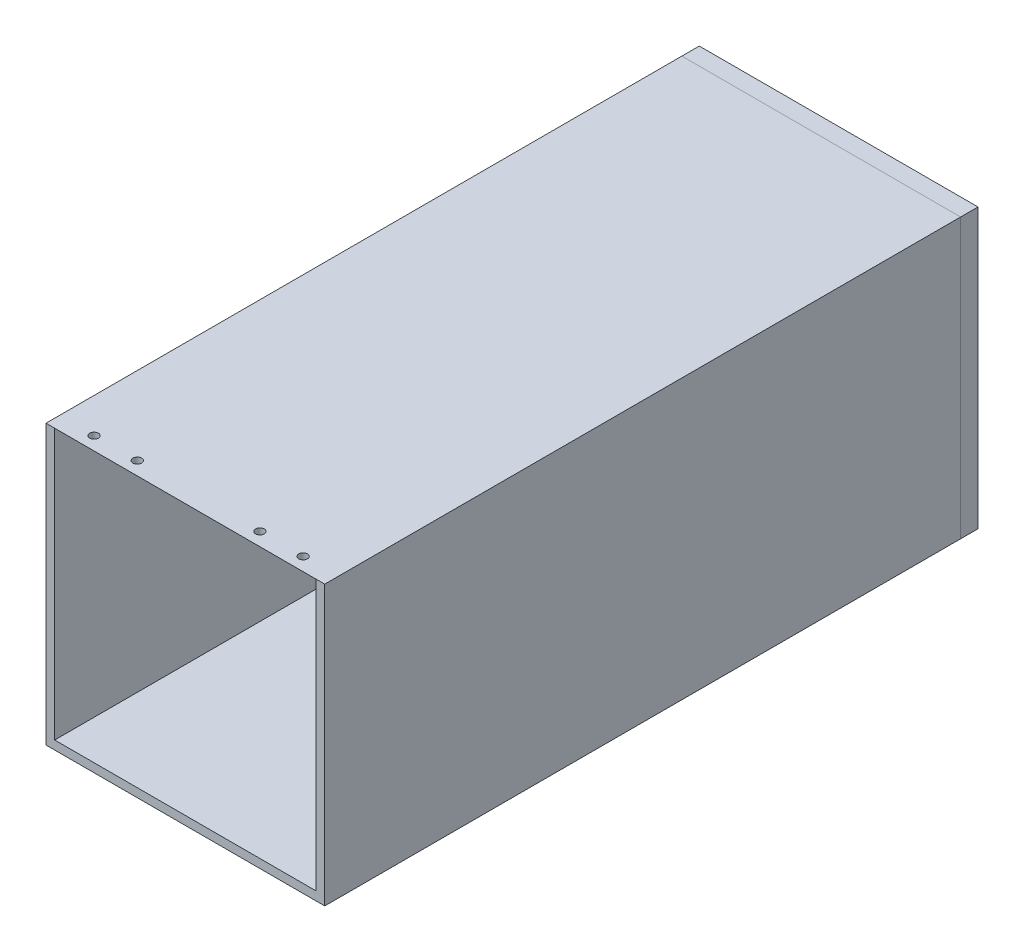
from build123d import *

# Parameters (mm, degrees)
SKETCH1_W           = 101.6
SKETCH1_H           = 101.6
SKETCH1_W_2         = 95.25
SKETCH1_H_2         = 95.25
BOSS_EXTRUDE1_DEPTH = 231.775
SKETCH2_W           = 101.6
SKETCH2_H           = 101.6
BOSS_EXTRUDE2_DEPTH = 6.35
CHAMFER1_SIZE       = 3.175
SKETCH3_R           = 1.5875
CUT_EXTRUDE1_DEPTH  = 17.78


with BuildPart() as part:
    # Sketch1 → Boss-Extrude1 (new body)
    with BuildSketch(Plane.XY):
        with Locations((-50.8, 50.8)):
            Rectangle(SKETCH1_W, SKETCH1_H)
        with Locations((-50.8, 50.8)):
            Rectangle(SKETCH1_W_2, SKETCH1_H_2, mode=Mode.SUBTRACT)
    extrude(amount=BOSS_EXTRUDE1_DEPTH)

    # Chamfer1
    chamfer1_edges = [part.edges().sort_by_distance(p)[0] for p in [
        (-50.8, 98.425, 231.775),
    ]]
    chamfer(chamfer1_edges, length=CHAMFER1_SIZE - 0.0001)  # a hair under: the kernel refuses the full size

    # Sketch3 → Cut-Extrude1 (cut)
    with BuildSketch(Plane(origin=(0, 101.6, 0), x_dir=(1, 0, 0), z_dir=(0, 1, 0))):
        with Locations(Location((-88.9, -226.949, 0), (0, 0, 270))):
            Circle(SKETCH3_R)
        with Locations(Location((-73.152, -226.949, 0), (0, 0, 270))):
            Circle(SKETCH3_R)
        with Locations(Location((-28.448, -226.949, 0), (0, 0, 270))):
            Circle(SKETCH3_R)
        with Locations(Location((-12.7, -226.949, 0), (0, 0, 270))):
            Circle(SKETCH3_R)
    extrude(amount=-CUT_EXTRUDE1_DEPTH, mode=Mode.SUBTRACT)


with BuildPart() as body_2:
    # Sketch2 → Boss-Extrude2 (new body)
    with BuildSketch(Plane(origin=(0, 0, 0), x_dir=(-1, 0, 0), z_dir=(0, 0, -1))):
        with Locations((50.8, 50.8)):
            Rectangle(SKETCH2_W, SKETCH2_H)
    extrude(amount=BOSS_EXTRUDE2_DEPTH)


solid = Compound([part.part, body_2.part])
